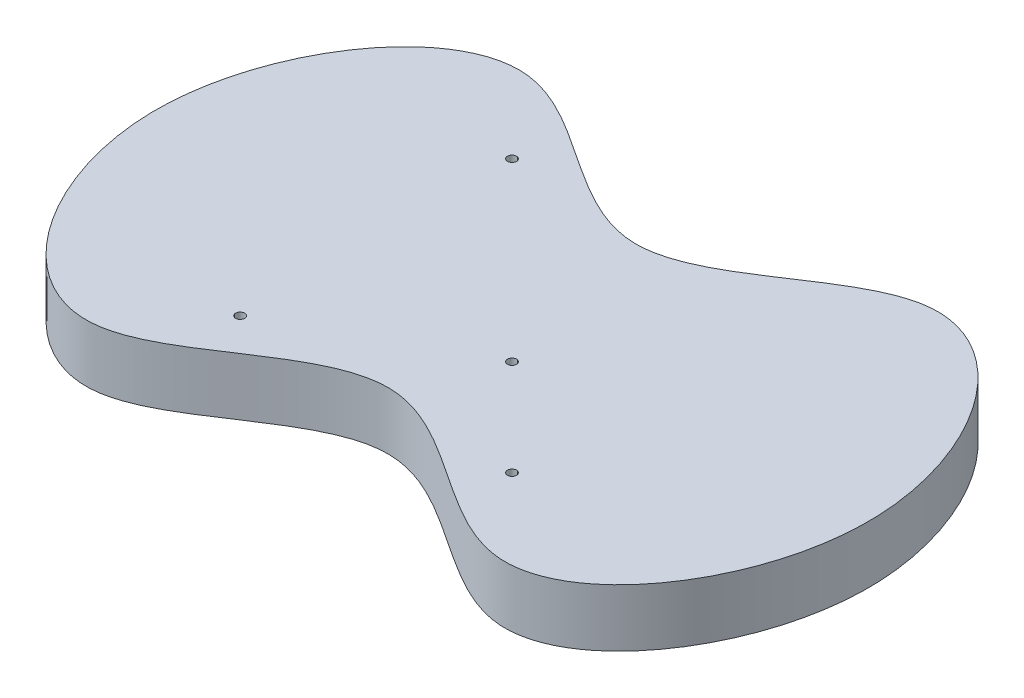
from build123d import *

# Parameters (mm, degrees)
PNPUSH_MARKER_PATTERN_SKETCH_DEPTH       = 12.7
SKETCH1_PNPUSH_MARKER_PATTERN_SKETCH_2_R = 1
CUT_EXTRUDE1_DEPTH                       = 93.891715355


# Read off the part's stored shape, not the designer's step: PNPush_Marker_Pattern_Sketch
with BuildPart() as part:
    # PNPush_Marker_Pattern_Sketch outline → PNPush_Marker_Pattern_Sketch (new body)
    with BuildSketch(Plane(origin=(0, 0, 0), x_dir=(1, 0, 0), z_dir=(0, 1, 0))):
        with BuildLine():
            add(Edge.make_bspline(
                [(0, 27.379017703), (-15.205424711, 27.379017703), (-48.390172134, 69.625294254), (-95.028597808, 0), (-48.390172134, -69.625294254), (0, -8.021552983), (48.390172134, -69.625294254), (95.028597808, 0), (48.390172134, 69.625294254), (15.205424711, 27.379017703), (0, 27.379017703)],
                knots=[0, 0, 0, 0, 0.114551307, 0.25, 0.385448693, 0.5, 0.614551307, 0.75, 0.885448693, 1, 1, 1, 1], degree=3))
        make_face()
    extrude(amount=PNPUSH_MARKER_PATTERN_SKETCH_DEPTH)

    # Sketch1-PNPush_Marker_Pattern_Sketch<2> → Cut-Extrude1 (cut, through all)
    with BuildSketch(Plane(origin=(0, 0, 0), x_dir=(1, 0, 0), z_dir=(0, 1, 0))):
        with Locations(Location((-30, 30, 0), (0, 0, 270))):
            Circle(SKETCH1_PNPUSH_MARKER_PATTERN_SKETCH_2_R)
        with Locations(Location((30, -30, 0), (0, 0, 270))):
            Circle(SKETCH1_PNPUSH_MARKER_PATTERN_SKETCH_2_R)
        with Locations(Location((-30, -30, 0), (0, 0, 270))):
            Circle(SKETCH1_PNPUSH_MARKER_PATTERN_SKETCH_2_R)
        with Locations(Location((8.786796564, -8.786796564, 0), (0, 0, 270))):
            Circle(SKETCH1_PNPUSH_MARKER_PATTERN_SKETCH_2_R)
    extrude(amount=CUT_EXTRUDE1_DEPTH, mode=Mode.SUBTRACT)


solid = part.part
